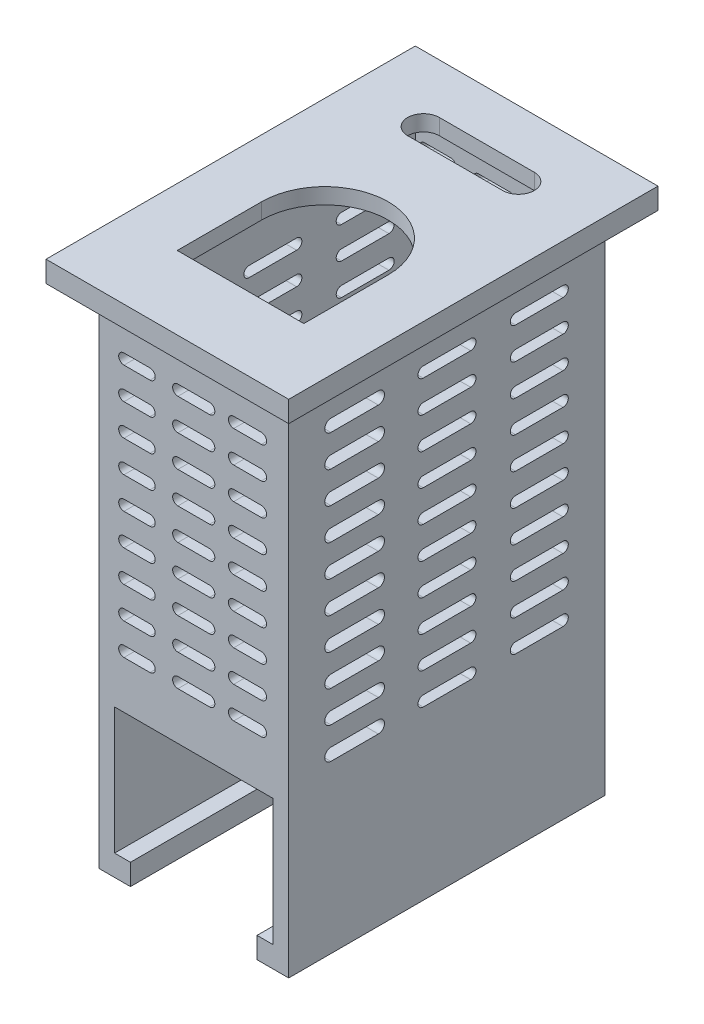
from build123d import *

# Parameters (mm, degrees)
BOSS_EXTRUDE1_DEPTH = 30
SHELL5_START        = -37.236894184
SHELL5_OUTLINE_W    = 34.5
SHELL5_OUTLINE_H    = 27
SHELL5_DEPTH        = 15
CUT_EXTRUDE1_DEPTH  = 46.350301392
CUT_EXTRUDE2_DEPTH  = 58.765744852
SKETCH4_W           = 12
SKETCH4_H           = 8
CUT_EXTRUDE4_DEPTH  = 72.417654974
SKETCH5_W           = 23
SKETCH5_H           = 2
BOSS_EXTRUDE2_DEPTH = 2.5
SKETCH6_W           = 23
SKETCH6_H           = 2
BOSS_EXTRUDE3_DEPTH = 2.5


# Read off the part's stored shape, not the designer's step: Shell5
with BuildPart() as part:
    # Sketch1 → Boss-Extrude1 (new body)
    with BuildSketch(Plane.XY):
        Polygon((-35.736894184, -25.136688013), (-37.236894184, -25.136688013), (-37.236894184, -13.136688013), (-22.236894184, -13.136688013), (-22.236894184, -25.136688013), (-23.736894184, -25.136688013), (-23.736894184, -27.136688013), (-20.736894184, -27.136688013), (-20.736894184, 20.863311987), (-18.236894184, 20.863311987), (-18.236894184, 22.863311987), (-41.236894184, 22.863311987), (-41.236894184, 20.863311987), (-38.736894184, 20.863311987), (-38.736894184, -27.136688013), (-35.736894184, -27.136688013), align=None)
    extrude(amount=BOSS_EXTRUDE1_DEPTH)

    # Shell5 outline → Shell5 (cut)
    with BuildSketch(Plane.YZ.offset(SHELL5_START)):
        with Locations((4.113311987, 15)):
            Rectangle(SHELL5_OUTLINE_W, SHELL5_OUTLINE_H)
    extrude(amount=SHELL5_DEPTH, mode=Mode.SUBTRACT)

    # Sketch2 → Cut-Extrude1 (cut, through all)
    with BuildSketch(Plane(origin=(-20.736894184, 0, 0), x_dir=(0, 0, -1), z_dir=(1, 0, 0))):
        with BuildLine():
            Line((-26, 16.812334052), (-21.503505124, 16.812334052))
            ThreePointArc((-21.503505124, 16.812334052), (-20.919601041, 16.228429969), (-21.503505124, 15.644525887))
            Line((-21.503505124, 15.644525887), (-26, 15.644525887))
            ThreePointArc((-26, 15.644525887), (-26.583904083, 16.228429969), (-26, 16.812334052))
        make_face()
        with BuildLine():
            Line((-17.248247438, 16.728429969), (-12.751752562, 16.728429969))
            ThreePointArc((-12.751752562, 16.728429969), (-12.251752562, 16.228429969), (-12.751752562, 15.728429969))
            Line((-12.751752562, 15.728429969), (-17.248247438, 15.728429969))
            ThreePointArc((-17.248247438, 15.728429969), (-17.748247438, 16.228429969), (-17.248247438, 16.728429969))
        make_face()
        with BuildLine():
            Line((-8.496494876, 16.711935199), (-4, 16.711935199))
            ThreePointArc((-4, 16.711935199), (-3.5, 16.211935199), (-4, 15.711935199))
            Line((-4, 15.711935199), (-8.496494876, 15.711935199))
            ThreePointArc((-8.496494876, 15.711935199), (-8.996494876, 16.211935199), (-8.496494876, 16.711935199))
        make_face()
        with BuildLine():
            Line((-26, 13.812334052), (-21.503505124, 13.812334052))
            ThreePointArc((-21.503505124, 13.812334052), (-20.919601041, 13.228429969), (-21.503505124, 12.644525887))
            Line((-21.503505124, 12.644525887), (-26, 12.644525887))
            ThreePointArc((-26, 12.644525887), (-26.583904083, 13.228429969), (-26, 13.812334052))
        make_face()
        with BuildLine():
            Line((-17.248247438, 13.728429969), (-12.751752562, 13.728429969))
            ThreePointArc((-12.751752562, 13.728429969), (-12.251752562, 13.228429969), (-12.751752562, 12.728429969))
            Line((-12.751752562, 12.728429969), (-17.248247438, 12.728429969))
            ThreePointArc((-17.248247438, 12.728429969), (-17.748247438, 13.228429969), (-17.248247438, 13.728429969))
        make_face()
        with BuildLine():
            Line((-8.496494876, 13.711935199), (-4, 13.711935199))
            ThreePointArc((-4, 13.711935199), (-3.5, 13.211935199), (-4, 12.711935199))
            Line((-4, 12.711935199), (-8.496494876, 12.711935199))
            ThreePointArc((-8.496494876, 12.711935199), (-8.996494876, 13.211935199), (-8.496494876, 13.711935199))
        make_face()
        with BuildLine():
            Line((-26, 10.812334052), (-21.503505124, 10.812334052))
            ThreePointArc((-21.503505124, 10.812334052), (-20.919601041, 10.228429969), (-21.503505124, 9.644525887))
            Line((-21.503505124, 9.644525887), (-26, 9.644525887))
            ThreePointArc((-26, 9.644525887), (-26.583904083, 10.228429969), (-26, 10.812334052))
        make_face()
        with BuildLine():
            Line((-17.248247438, 10.728429969), (-12.751752562, 10.728429969))
            ThreePointArc((-12.751752562, 10.728429969), (-12.251752562, 10.228429969), (-12.751752562, 9.728429969))
            Line((-12.751752562, 9.728429969), (-17.248247438, 9.728429969))
            ThreePointArc((-17.248247438, 9.728429969), (-17.748247438, 10.228429969), (-17.248247438, 10.728429969))
        make_face()
        with BuildLine():
            Line((-8.496494876, 10.711935199), (-4, 10.711935199))
            ThreePointArc((-4, 10.711935199), (-3.5, 10.211935199), (-4, 9.711935199))
            Line((-4, 9.711935199), (-8.496494876, 9.711935199))
            ThreePointArc((-8.496494876, 9.711935199), (-8.996494876, 10.211935199), (-8.496494876, 10.711935199))
        make_face()
        with BuildLine():
            Line((-26, 7.812334052), (-21.503505124, 7.812334052))
            ThreePointArc((-21.503505124, 7.812334052), (-20.919601041, 7.228429969), (-21.503505124, 6.644525887))
            Line((-21.503505124, 6.644525887), (-26, 6.644525887))
            ThreePointArc((-26, 6.644525887), (-26.583904083, 7.228429969), (-26, 7.812334052))
        make_face()
        with BuildLine():
            Line((-17.248247438, 7.728429969), (-12.751752562, 7.728429969))
            ThreePointArc((-12.751752562, 7.728429969), (-12.251752562, 7.228429969), (-12.751752562, 6.728429969))
            Line((-12.751752562, 6.728429969), (-17.248247438, 6.728429969))
            ThreePointArc((-17.248247438, 6.728429969), (-17.748247438, 7.228429969), (-17.248247438, 7.728429969))
        make_face()
        with BuildLine():
            Line((-8.496494876, 7.711935199), (-4, 7.711935199))
            ThreePointArc((-4, 7.711935199), (-3.5, 7.211935199), (-4, 6.711935199))
            Line((-4, 6.711935199), (-8.496494876, 6.711935199))
            ThreePointArc((-8.496494876, 6.711935199), (-8.996494876, 7.211935199), (-8.496494876, 7.711935199))
        make_face()
        with BuildLine():
            Line((-26, 4.812334052), (-21.503505124, 4.812334052))
            ThreePointArc((-21.503505124, 4.812334052), (-20.919601041, 4.228429969), (-21.503505124, 3.644525887))
            Line((-21.503505124, 3.644525887), (-26, 3.644525887))
            ThreePointArc((-26, 3.644525887), (-26.583904083, 4.228429969), (-26, 4.812334052))
        make_face()
        with BuildLine():
            Line((-17.248247438, 4.728429969), (-12.751752562, 4.728429969))
            ThreePointArc((-12.751752562, 4.728429969), (-12.251752562, 4.228429969), (-12.751752562, 3.728429969))
            Line((-12.751752562, 3.728429969), (-17.248247438, 3.728429969))
            ThreePointArc((-17.248247438, 3.728429969), (-17.748247438, 4.228429969), (-17.248247438, 4.728429969))
        make_face()
        with BuildLine():
            Line((-8.496494876, 4.711935199), (-4, 4.711935199))
            ThreePointArc((-4, 4.711935199), (-3.5, 4.211935199), (-4, 3.711935199))
            Line((-4, 3.711935199), (-8.496494876, 3.711935199))
            ThreePointArc((-8.496494876, 3.711935199), (-8.996494876, 4.211935199), (-8.496494876, 4.711935199))
        make_face()
        with BuildLine():
            Line((-26, 1.812334052), (-21.503505124, 1.812334052))
            ThreePointArc((-21.503505124, 1.812334052), (-20.919601041, 1.228429969), (-21.503505124, 0.644525887))
            Line((-21.503505124, 0.644525887), (-26, 0.644525887))
            ThreePointArc((-26, 0.644525887), (-26.583904083, 1.228429969), (-26, 1.812334052))
        make_face()
        with BuildLine():
            Line((-17.248247438, 1.728429969), (-12.751752562, 1.728429969))
            ThreePointArc((-12.751752562, 1.728429969), (-12.251752562, 1.228429969), (-12.751752562, 0.728429969))
            Line((-12.751752562, 0.728429969), (-17.248247438, 0.728429969))
            ThreePointArc((-17.248247438, 0.728429969), (-17.748247438, 1.228429969), (-17.248247438, 1.728429969))
        make_face()
        with BuildLine():
            Line((-8.496494876, 1.711935199), (-4, 1.711935199))
            ThreePointArc((-4, 1.711935199), (-3.5, 1.211935199), (-4, 0.711935199))
            Line((-4, 0.711935199), (-8.496494876, 0.711935199))
            ThreePointArc((-8.496494876, 0.711935199), (-8.996494876, 1.211935199), (-8.496494876, 1.711935199))
        make_face()
        with BuildLine():
            Line((-26, -1.187665948), (-21.503505124, -1.187665948))
            ThreePointArc((-21.503505124, -1.187665948), (-20.919601041, -1.771570031), (-21.503505124, -2.355474113))
            Line((-21.503505124, -2.355474113), (-26, -2.355474113))
            ThreePointArc((-26, -2.355474113), (-26.583904083, -1.771570031), (-26, -1.187665948))
        make_face()
        with BuildLine():
            Line((-17.248247438, -1.271570031), (-12.751752562, -1.271570031))
            ThreePointArc((-12.751752562, -1.271570031), (-12.251752562, -1.771570031), (-12.751752562, -2.271570031))
            Line((-12.751752562, -2.271570031), (-17.248247438, -2.271570031))
            ThreePointArc((-17.248247438, -2.271570031), (-17.748247438, -1.771570031), (-17.248247438, -1.271570031))
        make_face()
        with BuildLine():
            Line((-8.496494876, -1.288064801), (-4, -1.288064801))
            ThreePointArc((-4, -1.288064801), (-3.5, -1.788064801), (-4, -2.288064801))
            Line((-4, -2.288064801), (-8.496494876, -2.288064801))
            ThreePointArc((-8.496494876, -2.288064801), (-8.996494876, -1.788064801), (-8.496494876, -1.288064801))
        make_face()
        with BuildLine():
            Line((-26, -4.187665948), (-21.503505124, -4.187665948))
            ThreePointArc((-21.503505124, -4.187665948), (-20.919601041, -4.771570031), (-21.503505124, -5.355474113))
            Line((-21.503505124, -5.355474113), (-26, -5.355474113))
            ThreePointArc((-26, -5.355474113), (-26.583904083, -4.771570031), (-26, -4.187665948))
        make_face()
        with BuildLine():
            Line((-17.248247438, -4.271570031), (-12.751752562, -4.271570031))
            ThreePointArc((-12.751752562, -4.271570031), (-12.251752562, -4.771570031), (-12.751752562, -5.271570031))
            Line((-12.751752562, -5.271570031), (-17.248247438, -5.271570031))
            ThreePointArc((-17.248247438, -5.271570031), (-17.748247438, -4.771570031), (-17.248247438, -4.271570031))
        make_face()
        with BuildLine():
            Line((-8.496494876, -4.288064801), (-4, -4.288064801))
            ThreePointArc((-4, -4.288064801), (-3.5, -4.788064801), (-4, -5.288064801))
            Line((-4, -5.288064801), (-8.496494876, -5.288064801))
            ThreePointArc((-8.496494876, -5.288064801), (-8.996494876, -4.788064801), (-8.496494876, -4.288064801))
        make_face()
        with BuildLine():
            Line((-26, -7.187665948), (-21.503505124, -7.187665948))
            ThreePointArc((-21.503505124, -7.187665948), (-20.919601041, -7.771570031), (-21.503505124, -8.355474113))
            Line((-21.503505124, -8.355474113), (-26, -8.355474113))
            ThreePointArc((-26, -8.355474113), (-26.583904083, -7.771570031), (-26, -7.187665948))
        make_face()
        with BuildLine():
            Line((-17.248247438, -7.271570031), (-12.751752562, -7.271570031))
            ThreePointArc((-12.751752562, -7.271570031), (-12.251752562, -7.771570031), (-12.751752562, -8.271570031))
            Line((-12.751752562, -8.271570031), (-17.248247438, -8.271570031))
            ThreePointArc((-17.248247438, -8.271570031), (-17.748247438, -7.771570031), (-17.248247438, -7.271570031))
        make_face()
        with BuildLine():
            Line((-8.496494876, -7.288064801), (-4, -7.288064801))
            ThreePointArc((-4, -7.288064801), (-3.5, -7.788064801), (-4, -8.288064801))
            Line((-4, -8.288064801), (-8.496494876, -8.288064801))
            ThreePointArc((-8.496494876, -8.288064801), (-8.996494876, -7.788064801), (-8.496494876, -7.288064801))
        make_face()
        with BuildLine():
            Line((-26, -10.187665948), (-21.503505124, -10.187665948))
            ThreePointArc((-21.503505124, -10.187665948), (-20.919601041, -10.771570031), (-21.503505124, -11.355474113))
            Line((-21.503505124, -11.355474113), (-26, -11.355474113))
            ThreePointArc((-26, -11.355474113), (-26.583904083, -10.771570031), (-26, -10.187665948))
        make_face()
        with BuildLine():
            Line((-17.248247438, -10.271570031), (-12.751752562, -10.271570031))
            ThreePointArc((-12.751752562, -10.271570031), (-12.251752562, -10.771570031), (-12.751752562, -11.271570031))
            Line((-12.751752562, -11.271570031), (-17.248247438, -11.271570031))
            ThreePointArc((-17.248247438, -11.271570031), (-17.748247438, -10.771570031), (-17.248247438, -10.271570031))
        make_face()
        with BuildLine():
            Line((-8.496494876, -10.288064801), (-4, -10.288064801))
            ThreePointArc((-4, -10.288064801), (-3.5, -10.788064801), (-4, -11.288064801))
            Line((-4, -11.288064801), (-8.496494876, -11.288064801))
            ThreePointArc((-8.496494876, -11.288064801), (-8.996494876, -10.788064801), (-8.496494876, -10.288064801))
        make_face()
    extrude(amount=-CUT_EXTRUDE1_DEPTH, mode=Mode.SUBTRACT)

    # Sketch3 → Cut-Extrude2 (cut, through all)
    with BuildSketch(Plane(origin=(0, 0, 0), x_dir=(-1, 0, 0), z_dir=(0, 0, -1))):
        with BuildLine():
            Line((23.333846767, 19.363311987), (25.947552858, 19.363311987))
            ThreePointArc((25.947552858, 19.363311987), (26.447552858, 18.863311987), (25.947552858, 18.363311987))
            Line((25.947552858, 18.363311987), (23.333846767, 18.363311987))
            ThreePointArc((23.333846767, 18.363311987), (22.833846767, 18.863311987), (23.333846767, 19.363311987))
        make_face()
        with BuildLine():
            Line((28.236894184, 19.363311987), (31.236894184, 19.363311987))
            ThreePointArc((31.236894184, 19.363311987), (31.736894184, 18.863311987), (31.236894184, 18.363311987))
            Line((31.236894184, 18.363311987), (28.236894184, 18.363311987))
            ThreePointArc((28.236894184, 18.363311987), (27.736894184, 18.863311987), (28.236894184, 19.363311987))
        make_face()
        with BuildLine():
            Line((33.884735182, 19.363311987), (36.349864682, 19.363311987))
            ThreePointArc((36.349864682, 19.363311987), (36.849864682, 18.863311987), (36.349864682, 18.363311987))
            Line((36.349864682, 18.363311987), (33.884735182, 18.363311987))
            ThreePointArc((33.884735182, 18.363311987), (33.384735182, 18.863311987), (33.884735182, 19.363311987))
        make_face()
        with BuildLine():
            Line((23.333846767, 16.363311987), (25.947552858, 16.363311987))
            ThreePointArc((25.947552858, 16.363311987), (26.447552858, 15.863311987), (25.947552858, 15.363311987))
            Line((25.947552858, 15.363311987), (23.333846767, 15.363311987))
            ThreePointArc((23.333846767, 15.363311987), (22.833846767, 15.863311987), (23.333846767, 16.363311987))
        make_face()
        with BuildLine():
            Line((28.236894184, 16.363311987), (31.236894184, 16.363311987))
            ThreePointArc((31.236894184, 16.363311987), (31.736894184, 15.863311987), (31.236894184, 15.363311987))
            Line((31.236894184, 15.363311987), (28.236894184, 15.363311987))
            ThreePointArc((28.236894184, 15.363311987), (27.736894184, 15.863311987), (28.236894184, 16.363311987))
        make_face()
        with BuildLine():
            Line((33.884735182, 16.363311987), (36.349864682, 16.363311987))
            ThreePointArc((36.349864682, 16.363311987), (36.849864682, 15.863311987), (36.349864682, 15.363311987))
            Line((36.349864682, 15.363311987), (33.884735182, 15.363311987))
            ThreePointArc((33.884735182, 15.363311987), (33.384735182, 15.863311987), (33.884735182, 16.363311987))
        make_face()
        with BuildLine():
            Line((23.333846767, 13.363311987), (25.947552858, 13.363311987))
            ThreePointArc((25.947552858, 13.363311987), (26.447552858, 12.863311987), (25.947552858, 12.363311987))
            Line((25.947552858, 12.363311987), (23.333846767, 12.363311987))
            ThreePointArc((23.333846767, 12.363311987), (22.833846767, 12.863311987), (23.333846767, 13.363311987))
        make_face()
        with BuildLine():
            Line((28.236894184, 13.363311987), (31.236894184, 13.363311987))
            ThreePointArc((31.236894184, 13.363311987), (31.736894184, 12.863311987), (31.236894184, 12.363311987))
            Line((31.236894184, 12.363311987), (28.236894184, 12.363311987))
            ThreePointArc((28.236894184, 12.363311987), (27.736894184, 12.863311987), (28.236894184, 13.363311987))
        make_face()
        with BuildLine():
            Line((33.884735182, 13.363311987), (36.349864682, 13.363311987))
            ThreePointArc((36.349864682, 13.363311987), (36.849864682, 12.863311987), (36.349864682, 12.363311987))
            Line((36.349864682, 12.363311987), (33.884735182, 12.363311987))
            ThreePointArc((33.884735182, 12.363311987), (33.384735182, 12.863311987), (33.884735182, 13.363311987))
        make_face()
        with BuildLine():
            Line((23.333846767, 10.363311987), (25.947552858, 10.363311987))
            ThreePointArc((25.947552858, 10.363311987), (26.447552858, 9.863311987), (25.947552858, 9.363311987))
            Line((25.947552858, 9.363311987), (23.333846767, 9.363311987))
            ThreePointArc((23.333846767, 9.363311987), (22.833846767, 9.863311987), (23.333846767, 10.363311987))
        make_face()
        with BuildLine():
            Line((28.236894184, 10.363311987), (31.236894184, 10.363311987))
            ThreePointArc((31.236894184, 10.363311987), (31.736894184, 9.863311987), (31.236894184, 9.363311987))
            Line((31.236894184, 9.363311987), (28.236894184, 9.363311987))
            ThreePointArc((28.236894184, 9.363311987), (27.736894184, 9.863311987), (28.236894184, 10.363311987))
        make_face()
        with BuildLine():
            Line((33.884735182, 10.363311987), (36.349864682, 10.363311987))
            ThreePointArc((36.349864682, 10.363311987), (36.849864682, 9.863311987), (36.349864682, 9.363311987))
            Line((36.349864682, 9.363311987), (33.884735182, 9.363311987))
            ThreePointArc((33.884735182, 9.363311987), (33.384735182, 9.863311987), (33.884735182, 10.363311987))
        make_face()
        with BuildLine():
            Line((23.333846767, 7.363311987), (25.947552858, 7.363311987))
            ThreePointArc((25.947552858, 7.363311987), (26.447552858, 6.863311987), (25.947552858, 6.363311987))
            Line((25.947552858, 6.363311987), (23.333846767, 6.363311987))
            ThreePointArc((23.333846767, 6.363311987), (22.833846767, 6.863311987), (23.333846767, 7.363311987))
        make_face()
        with BuildLine():
            Line((28.236894184, 7.363311987), (31.236894184, 7.363311987))
            ThreePointArc((31.236894184, 7.363311987), (31.736894184, 6.863311987), (31.236894184, 6.363311987))
            Line((31.236894184, 6.363311987), (28.236894184, 6.363311987))
            ThreePointArc((28.236894184, 6.363311987), (27.736894184, 6.863311987), (28.236894184, 7.363311987))
        make_face()
        with BuildLine():
            Line((33.884735182, 7.363311987), (36.349864682, 7.363311987))
            ThreePointArc((36.349864682, 7.363311987), (36.849864682, 6.863311987), (36.349864682, 6.363311987))
            Line((36.349864682, 6.363311987), (33.884735182, 6.363311987))
            ThreePointArc((33.884735182, 6.363311987), (33.384735182, 6.863311987), (33.884735182, 7.363311987))
        make_face()
        with BuildLine():
            Line((23.333846767, 4.363311987), (25.947552858, 4.363311987))
            ThreePointArc((25.947552858, 4.363311987), (26.447552858, 3.863311987), (25.947552858, 3.363311987))
            Line((25.947552858, 3.363311987), (23.333846767, 3.363311987))
            ThreePointArc((23.333846767, 3.363311987), (22.833846767, 3.863311987), (23.333846767, 4.363311987))
        make_face()
        with BuildLine():
            Line((28.236894184, 4.363311987), (31.236894184, 4.363311987))
            ThreePointArc((31.236894184, 4.363311987), (31.736894184, 3.863311987), (31.236894184, 3.363311987))
            Line((31.236894184, 3.363311987), (28.236894184, 3.363311987))
            ThreePointArc((28.236894184, 3.363311987), (27.736894184, 3.863311987), (28.236894184, 4.363311987))
        make_face()
        with BuildLine():
            Line((33.884735182, 4.363311987), (36.349864682, 4.363311987))
            ThreePointArc((36.349864682, 4.363311987), (36.849864682, 3.863311987), (36.349864682, 3.363311987))
            Line((36.349864682, 3.363311987), (33.884735182, 3.363311987))
            ThreePointArc((33.884735182, 3.363311987), (33.384735182, 3.863311987), (33.884735182, 4.363311987))
        make_face()
        with BuildLine():
            Line((23.333846767, 1.363311987), (25.947552858, 1.363311987))
            ThreePointArc((25.947552858, 1.363311987), (26.447552858, 0.863311987), (25.947552858, 0.363311987))
            Line((25.947552858, 0.363311987), (23.333846767, 0.363311987))
            ThreePointArc((23.333846767, 0.363311987), (22.833846767, 0.863311987), (23.333846767, 1.363311987))
        make_face()
        with BuildLine():
            Line((28.236894184, 1.363311987), (31.236894184, 1.363311987))
            ThreePointArc((31.236894184, 1.363311987), (31.736894184, 0.863311987), (31.236894184, 0.363311987))
            Line((31.236894184, 0.363311987), (28.236894184, 0.363311987))
            ThreePointArc((28.236894184, 0.363311987), (27.736894184, 0.863311987), (28.236894184, 1.363311987))
        make_face()
        with BuildLine():
            Line((33.884735182, 1.363311987), (36.349864682, 1.363311987))
            ThreePointArc((36.349864682, 1.363311987), (36.849864682, 0.863311987), (36.349864682, 0.363311987))
            Line((36.349864682, 0.363311987), (33.884735182, 0.363311987))
            ThreePointArc((33.884735182, 0.363311987), (33.384735182, 0.863311987), (33.884735182, 1.363311987))
        make_face()
        with BuildLine():
            Line((23.333846767, -1.636688013), (25.947552858, -1.636688013))
            ThreePointArc((25.947552858, -1.636688013), (26.447552858, -2.136688013), (25.947552858, -2.636688013))
            Line((25.947552858, -2.636688013), (23.333846767, -2.636688013))
            ThreePointArc((23.333846767, -2.636688013), (22.833846767, -2.136688013), (23.333846767, -1.636688013))
        make_face()
        with BuildLine():
            Line((28.236894184, -1.636688013), (31.236894184, -1.636688013))
            ThreePointArc((31.236894184, -1.636688013), (31.736894184, -2.136688013), (31.236894184, -2.636688013))
            Line((31.236894184, -2.636688013), (28.236894184, -2.636688013))
            ThreePointArc((28.236894184, -2.636688013), (27.736894184, -2.136688013), (28.236894184, -1.636688013))
        make_face()
        with BuildLine():
            Line((33.884735182, -1.636688013), (36.349864682, -1.636688013))
            ThreePointArc((36.349864682, -1.636688013), (36.849864682, -2.136688013), (36.349864682, -2.636688013))
            Line((36.349864682, -2.636688013), (33.884735182, -2.636688013))
            ThreePointArc((33.884735182, -2.636688013), (33.384735182, -2.136688013), (33.884735182, -1.636688013))
        make_face()
        with BuildLine():
            Line((23.333846767, -4.636688013), (25.947552858, -4.636688013))
            ThreePointArc((25.947552858, -4.636688013), (26.447552858, -5.136688013), (25.947552858, -5.636688013))
            Line((25.947552858, -5.636688013), (23.333846767, -5.636688013))
            ThreePointArc((23.333846767, -5.636688013), (22.833846767, -5.136688013), (23.333846767, -4.636688013))
        make_face()
        with BuildLine():
            Line((28.236894184, -4.636688013), (31.236894184, -4.636688013))
            ThreePointArc((31.236894184, -4.636688013), (31.736894184, -5.136688013), (31.236894184, -5.636688013))
            Line((31.236894184, -5.636688013), (28.236894184, -5.636688013))
            ThreePointArc((28.236894184, -5.636688013), (27.736894184, -5.136688013), (28.236894184, -4.636688013))
        make_face()
        with BuildLine():
            Line((33.884735182, -4.636688013), (36.349864682, -4.636688013))
            ThreePointArc((36.349864682, -4.636688013), (36.849864682, -5.136688013), (36.349864682, -5.636688013))
            Line((36.349864682, -5.636688013), (33.884735182, -5.636688013))
            ThreePointArc((33.884735182, -5.636688013), (33.384735182, -5.136688013), (33.884735182, -4.636688013))
        make_face()
        with BuildLine():
            Line((23.333846767, -7.636688013), (25.947552858, -7.636688013))
            ThreePointArc((25.947552858, -7.636688013), (26.447552858, -8.136688013), (25.947552858, -8.636688013))
            Line((25.947552858, -8.636688013), (23.333846767, -8.636688013))
            ThreePointArc((23.333846767, -8.636688013), (22.833846767, -8.136688013), (23.333846767, -7.636688013))
        make_face()
        with BuildLine():
            Line((28.236894184, -7.636688013), (31.236894184, -7.636688013))
            ThreePointArc((31.236894184, -7.636688013), (31.736894184, -8.136688013), (31.236894184, -8.636688013))
            Line((31.236894184, -8.636688013), (28.236894184, -8.636688013))
            ThreePointArc((28.236894184, -8.636688013), (27.736894184, -8.136688013), (28.236894184, -7.636688013))
        make_face()
        with BuildLine():
            Line((33.884735182, -7.636688013), (36.349864682, -7.636688013))
            ThreePointArc((36.349864682, -7.636688013), (36.849864682, -8.136688013), (36.349864682, -8.636688013))
            Line((36.349864682, -8.636688013), (33.884735182, -8.636688013))
            ThreePointArc((33.884735182, -8.636688013), (33.384735182, -8.136688013), (33.884735182, -7.636688013))
        make_face()
    extrude(amount=-CUT_EXTRUDE2_DEPTH, mode=Mode.SUBTRACT)

    # Sketch4 → Cut-Extrude4 (cut, through all)
    with BuildSketch(Plane(origin=(0, 22.863311987, 0), x_dir=(1, 0, 0), z_dir=(0, 1, 0))):
        with Locations((-29.736894184, -21.56622498)):
            Rectangle(SKETCH4_W, SKETCH4_H)
        with BuildLine():
            ThreePointArc((-35.736894184, -17.56622498), (-29.736894184, -11.56622498), (-23.736894184, -17.56622498))
            Line((-23.736894184, -17.56622498), (-35.736894184, -17.56622498))
        make_face()
        with BuildLine():
            Line((-34.233763413, -5.225707766), (-25.233763413, -5.225707766))
            ThreePointArc((-25.233763413, -5.225707766), (-23.733763413, -3.725707766), (-25.233763413, -2.225707766))
            Line((-25.233763413, -2.225707766), (-34.233763413, -2.225707766))
            ThreePointArc((-34.233763413, -2.225707766), (-35.733763413, -3.725707766), (-34.233763413, -5.225707766))
        make_face()
    extrude(amount=-CUT_EXTRUDE4_DEPTH, mode=Mode.SUBTRACT)

    # Sketch5 → Boss-Extrude2 (add)
    with BuildSketch(Plane.XY.offset(30)):
        with Locations((-29.736894184, 21.863311987)):
            Rectangle(SKETCH5_W, SKETCH5_H)
    extrude(amount=BOSS_EXTRUDE2_DEPTH)

    # Sketch6 → Boss-Extrude3 (add)
    with BuildSketch(Plane(origin=(0, 0, 0), x_dir=(-1, 0, 0), z_dir=(0, 0, -1))):
        with Locations((29.736894184, 21.863311987)):
            Rectangle(SKETCH6_W, SKETCH6_H)
    extrude(amount=BOSS_EXTRUDE3_DEPTH)


solid = part.part
